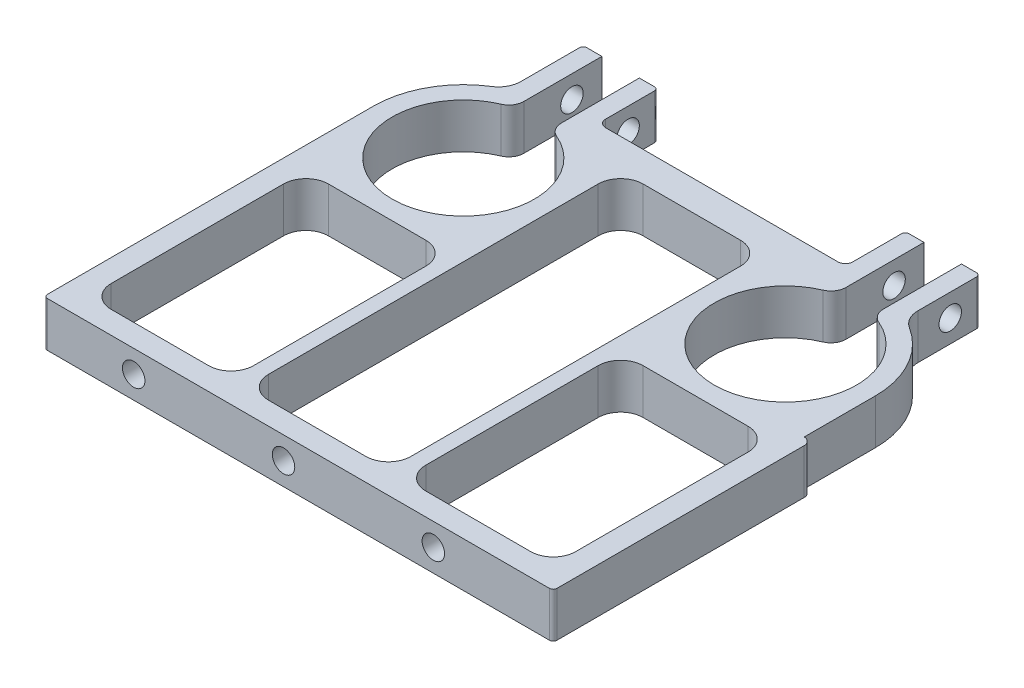
from build123d import *

# Parameters (mm, degrees)
SKETCH_1_W          = 19
SKETCH_1_H          = 29
SKETCH_1_W_2        = 20
EXTRUDE_1_DEPTH     = 6
SKETCH_3_R          = 1.5
CUT_EXTRUDE_1_DEPTH = 10
FILLET_1_R          = 3
FILLET_2_R          = 1
SKETCH_4_R          = 1.5
CUT_EXTRUDE_2_DEPTH = 72
FILLET_3_R          = 0.5
FILLET_4_R          = 0.5
FILLET_5_R          = 3
FILLET_6_R          = 2


with BuildPart() as part:
    # 草图1 → 凸台-拉伸1 (new body)
    with BuildSketch(Plane(origin=(0, 0, 0), x_dir=(1, 0, 0), z_dir=(0, 1, 0))):
        with BuildLine():
            Line((17, 0), (50, 0))
            Line((50, 0), (50, 8))
            Line((50, 8), (52.5, 8))
            Line((52.5, 8), (52.5, -3.83484861))
            ThreePointArc((52.5, -3.83484861), (55, -22.5), (57.5, -3.83484861))
            Line((57.5, -3.83484861), (57.5, 8))
            Line((57.5, 8), (60, 8))
            Line((60, 8), (60, -2.091287885))
            ThreePointArc((60, -2.091287885), (65.099504938, -6.519259302), (67, -13))
            Line((67, -13), (67, -22.5))
            Line((67, -22.5), (68, -22.5))
            Line((68, -22.5), (68, -57))
            Line((68, -57), (0, -57))
            Line((0, -57), (0, -13))
            ThreePointArc((0, -13), (1.900495062, -6.519259302), (7, -2.091287885))
            Line((7, -2.091287885), (7, 8))
            Line((7, 8), (9.5, 8))
            Line((9.5, 8), (9.5, -3.83484861))
            ThreePointArc((9.5, -3.83484861), (12, -22.5), (14.5, -3.83484861))
            Line((14.5, -3.83484861), (14.5, 8))
            Line((14.5, 8), (17, 8))
            Line((17, 8), (17, 0))
        make_face()
        with Locations((12.5, -39.5)):
            Rectangle(SKETCH_1_W, SKETCH_1_H, mode=Mode.SUBTRACT)
        Polygon((24, -25), (24, -54), (43, -54), (43, -25), (43, -4), (24, -4), align=None, mode=Mode.SUBTRACT)
        with Locations((55, -39.5)):
            Rectangle(SKETCH_1_W_2, SKETCH_1_H, mode=Mode.SUBTRACT)
    extrude(amount=EXTRUDE_1_DEPTH)

    # 草图3 → 切除-拉伸1 (cut)
    with BuildSketch(Plane.XY.offset(57)):
        with Locations((12, 3)):
            Circle(SKETCH_3_R)
        with Locations((32, 3)):
            Circle(SKETCH_3_R)
        with Locations((52, 3)):
            Circle(SKETCH_3_R)
    extrude(amount=-CUT_EXTRUDE_1_DEPTH, mode=Mode.SUBTRACT)

    # 圆角1
    fillet_1_edges = [part.edges().sort_by_distance(p)[0] for p in [
        (22, 3, 25),
        (3, 3, 25),
        (3, 3, 54),
        (22, 3, 54),
        (24, 3, 4),
        (24, 3, 54),
        (43, 3, 54),
        (43, 3, 4),
        (45, 3, 54),
        (65, 3, 54),
        (65, 3, 25),
        (45, 3, 25),
    ]]
    fillet(fillet_1_edges, radius=FILLET_1_R)

    # 圆角2
    fillet_2_edges = [part.edges().sort_by_distance(p)[0] for p in [
        (50, 3, 0),
        (17, 3, 0),
        (68, 3, 22.5),
    ]]
    fillet(fillet_2_edges, radius=FILLET_2_R - 0.0001)  # a hair under: the kernel refuses the full size

    # 草图4 → 切除-拉伸2 (cut)
    with BuildSketch(Plane.ZY.offset(-7)):
        with Locations((-4, 3)):
            Circle(SKETCH_4_R)
    extrude(amount=-CUT_EXTRUDE_2_DEPTH, mode=Mode.SUBTRACT)

    # 圆角3
    fillet_3_edges = [part.edges().sort_by_distance(p)[0] for p in [
        (68, 3, 57),
        (0, 3, 57),
    ]]
    fillet(fillet_3_edges, radius=FILLET_3_R)

    # 圆角4
    fillet_4_edges = [part.edges().sort_by_distance(p)[0] for p in [
        (7, 3, -8),
        (17, 3, -8),
        (50, 3, -8),
        (60, 3, -8),
    ]]
    fillet(fillet_4_edges, radius=FILLET_4_R)

    # 圆角5
    fillet_5_edges = [part.edges().sort_by_distance(p)[0] for p in [
        (7, 3, 2.091287885),
        (60, 3, 2.091287885),
    ]]
    fillet(fillet_5_edges, radius=FILLET_5_R)

    # 圆角6
    fillet_6_edges = [part.edges().sort_by_distance(p)[0] for p in [
        (9.5, 3, 3.83484861),
        (14.5, 3, 3.83484861),
        (52.5, 3, 3.83484861),
        (57.5, 3, 3.83484861),
    ]]
    fillet(fillet_6_edges, radius=FILLET_6_R)


solid = part.part
